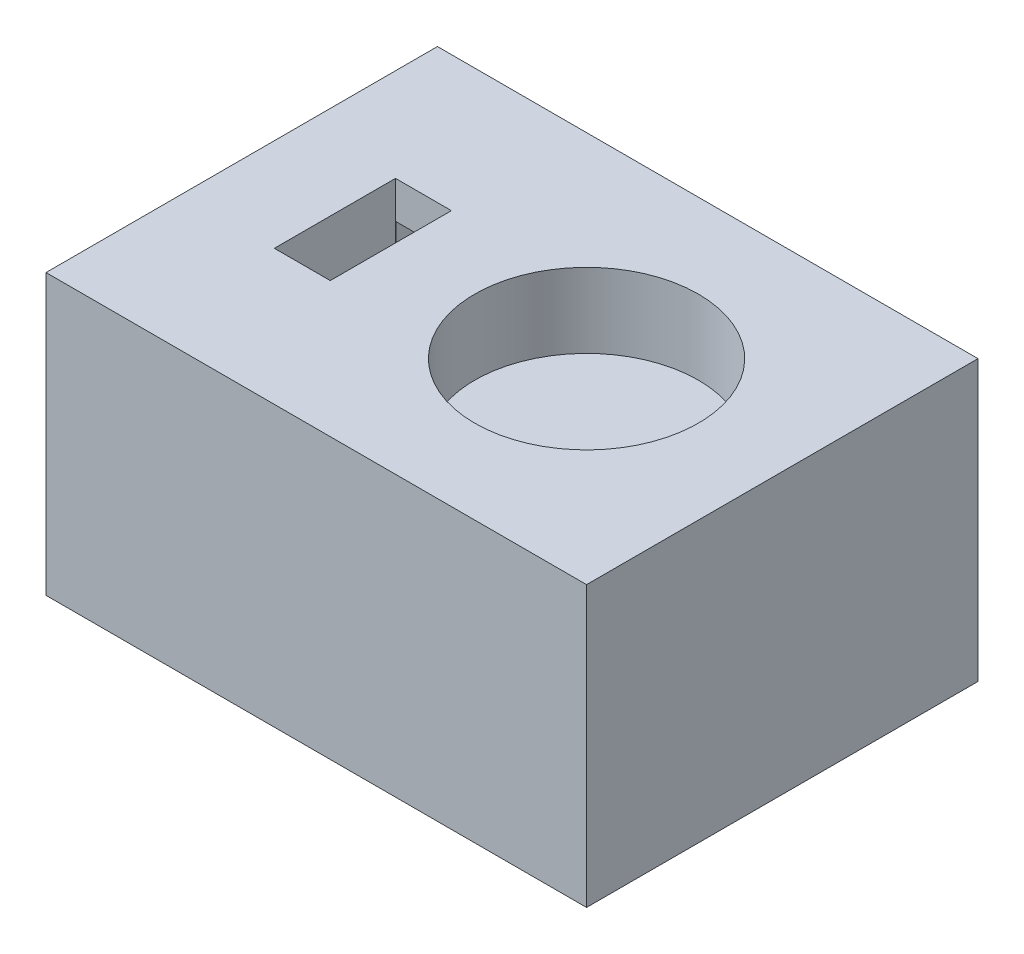
from build123d import *

# Parameters (mm, degrees)
ESQUISSE1_W             = 42
ESQUISSE1_H             = 42
BOSS_EXTRU_1_DEPTH      = 30
ESQUISSE2_R             = 12
ENL_V_MAT_EXTRU_1_DEPTH = 8
ESQUISSE4_W             = 42
ESQUISSE4_H             = 30
BOSS_EXTRU_3_DEPTH      = 16
ESQUISSE5_W             = 6
ESQUISSE5_H             = 13
ENL_V_MAT_EXTRU_2_DEPTH = 11
ESQUISSE6_W             = 5.949379811
ESQUISSE6_H             = 6
ENL_V_MAT_EXTRU_3_DEPTH = 56.00227268


with BuildPart() as part:
    # Esquisse1 → Boss.-Extru.1 (new body)
    with BuildSketch(Plane(origin=(0, 0, 0), x_dir=(1, 0, 0), z_dir=(0, 1, 0))):
        Rectangle(ESQUISSE1_W, ESQUISSE1_H)
    extrude(amount=BOSS_EXTRU_1_DEPTH)

    # Esquisse2 → Enlèv. mat.-Extru.1 (cut)
    with BuildSketch(Plane(origin=(0, 30, 0), x_dir=(1, 0, 0), z_dir=(0, 1, 0))):
        Circle(ESQUISSE2_R)
    extrude(amount=-ENL_V_MAT_EXTRU_1_DEPTH, mode=Mode.SUBTRACT)

    # Esquisse4 → Boss.-Extru.3 (add)
    with BuildSketch(Plane.ZY.offset(21)):
        with Locations((0, 15)):
            Rectangle(ESQUISSE4_W, ESQUISSE4_H)
    extrude(amount=BOSS_EXTRU_3_DEPTH)

    # Esquisse5 → Enlèv. mat.-Extru.2 (cut)
    with BuildSketch(Plane(origin=(0, 30, 0), x_dir=(1, 0, 0), z_dir=(0, 1, 0))):
        with Locations((-24, 0)):
            Rectangle(ESQUISSE5_W, ESQUISSE5_H)
    extrude(amount=-ENL_V_MAT_EXTRU_2_DEPTH, mode=Mode.SUBTRACT)

    # Esquisse6 → Enlèv. mat.-Extru.3 (cut, through all)
    with BuildSketch(Plane.XY.offset(-6.5)):
        with Locations((-23.974689906, 23.009155876)):
            Rectangle(ESQUISSE6_W, ESQUISSE6_H)
    extrude(amount=-ENL_V_MAT_EXTRU_3_DEPTH, mode=Mode.SUBTRACT)


solid = part.part
